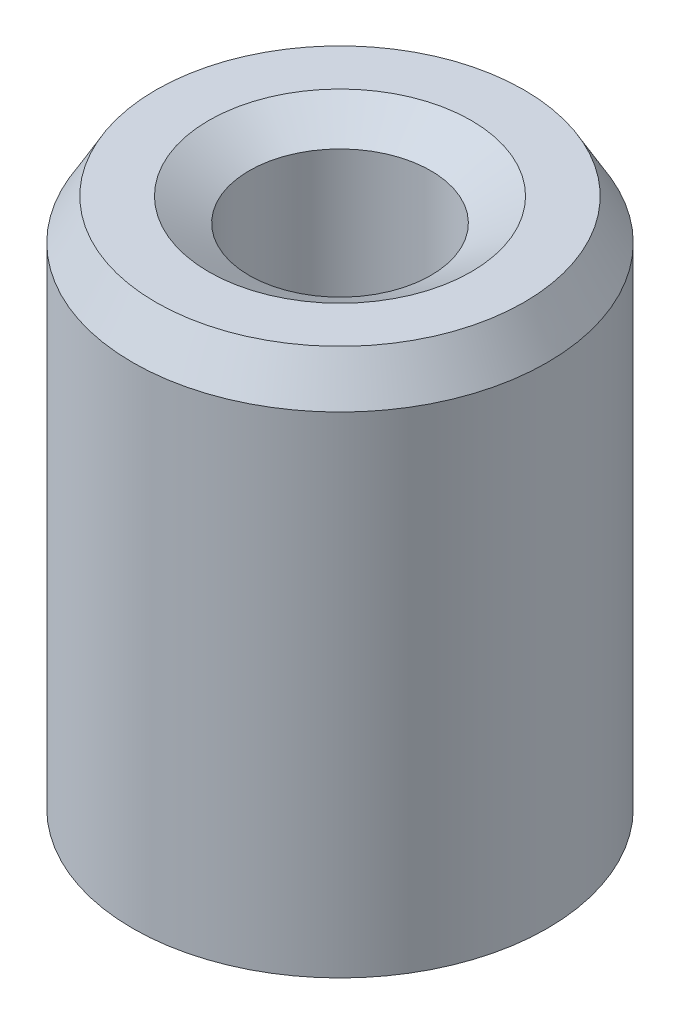
from build123d import *
from OCP.BRepFilletAPI import BRepFilletAPI_MakeChamfer

# Parameters (mm, degrees)
SKETCH1_R           = 10
BOSS_EXTRUDE1_DEPTH = 26.710439745
SKETCH2_R           = 4.379131984
CUT_EXTRUDE1_DEPTH  = 31.223295508
CHAMFER1_SIZE       = 1.948880962
CHAMFER1_SIZE2      = 1.125186948


with BuildPart() as part:
    # Sketch1 → Boss-Extrude1 (new body)
    with BuildSketch(Plane(origin=(0, 0, 0), x_dir=(1, 0, 0), z_dir=(0, 1, 0))):
        Circle(SKETCH1_R)
    extrude(amount=BOSS_EXTRUDE1_DEPTH)

    # Sketch2 → Cut-Extrude1 (cut, through all)
    with BuildSketch(Plane(origin=(0, 0, 0), x_dir=(1, 0, 0), z_dir=(0, 1, 0))):
        Circle(SKETCH2_R)
    extrude(amount=CUT_EXTRUDE1_DEPTH, mode=Mode.SUBTRACT)

    # Chamfer1: one chamfer whose edges measure the first distance from different faces: ONE call of the kernel's chamfer builder (chamfer() names one face for all edges)
    chamfer1_edges_1 = [part.edges().sort_by_distance(p)[0] for p in [
        (-4.379131984, 26.710439745, 0),
    ]]
    chamfer1_side_1 = [part.faces().sort_by_distance(p)[0] for p in [
        (-9.717157288, 26.710439745, 0),
    ]]
    chamfer1_edges_2 = [part.edges().sort_by_distance(p)[0] for p in [
        (-4.379131984, 0, 0),
    ]]
    chamfer1_side_2 = [part.faces().sort_by_distance(p)[0] for p in [
        (-4.379131984, 13.355219872, 0),
    ]]
    chamfer1_edges_3 = [part.edges().sort_by_distance(p)[0] for p in [
        (-10, 0, 0),
    ]]
    chamfer1_side_3 = [part.faces().sort_by_distance(p)[0] for p in [
        (-9.717157288, 0, 0),
    ]]
    chamfer1_edges_4 = [part.edges().sort_by_distance(p)[0] for p in [
        (-10, 26.710439745, 0),
    ]]
    chamfer1_side_4 = [part.faces().sort_by_distance(p)[0] for p in [
        (-10, 13.355219872, 0),
    ]]
    chamfer1 = BRepFilletAPI_MakeChamfer(part.part.solid().wrapped)
    for e in chamfer1_edges_1:
        chamfer1.Add(CHAMFER1_SIZE, CHAMFER1_SIZE2, e.wrapped, chamfer1_side_1[0].wrapped)  # the first distance lies on this face
    for e in chamfer1_edges_2:
        chamfer1.Add(CHAMFER1_SIZE, CHAMFER1_SIZE2, e.wrapped, chamfer1_side_2[0].wrapped)  # the first distance lies on this face
    for e in chamfer1_edges_3:
        chamfer1.Add(CHAMFER1_SIZE, CHAMFER1_SIZE2, e.wrapped, chamfer1_side_3[0].wrapped)  # the first distance lies on this face
    for e in chamfer1_edges_4:
        chamfer1.Add(CHAMFER1_SIZE, CHAMFER1_SIZE2, e.wrapped, chamfer1_side_4[0].wrapped)  # the first distance lies on this face
    add(Compound.cast(chamfer1.Shape()), mode=Mode.REPLACE)


solid = part.part
